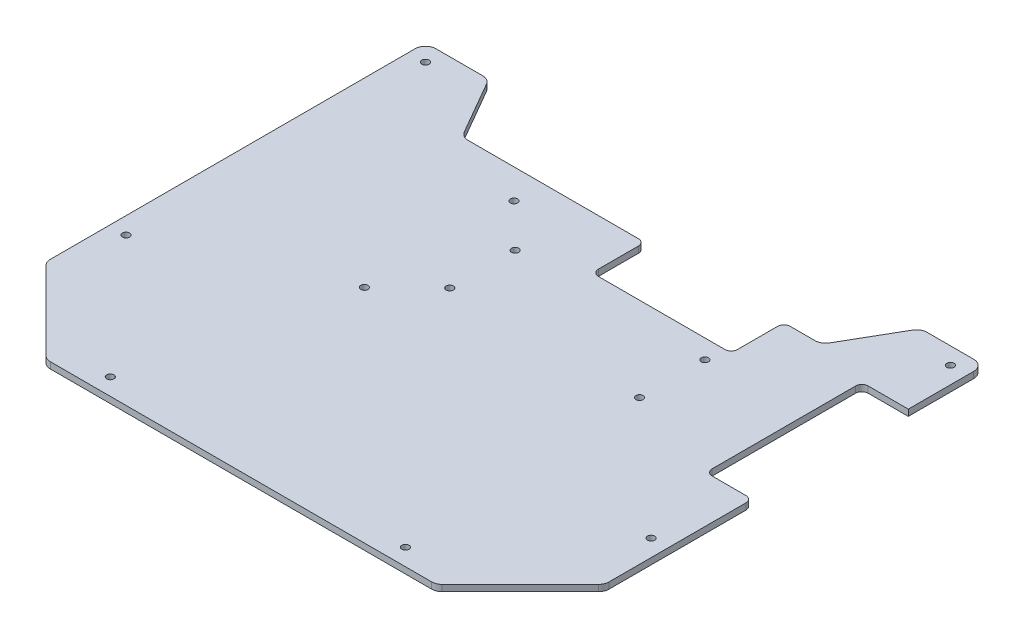
from build123d import *

# Parameters (mm, degrees)
BOSS_EXTRU_1_DEPTH      = 3
CONG_1_R                = 5
ESQUISSE2_R             = 1
ENL_V_MAT_EXTRU_1_DEPTH = 3
D_GAGEMENT_M31_D        = 3.4
ESQUISSE5_W             = 66
ESQUISSE5_H             = 25
ESQUISSE5_W_2           = 22
ESQUISSE5_H_2           = 74
ENL_V_MAT_EXTRU_2_DEPTH = 257.837010573
CONG_2_R                = 3
ESQUISSE6_R             = 1
ENL_V_MAT_EXTRU_3_DEPTH = 257.837010573
D_GAGEMENT_M32_D        = 3.4
D_GAGEMENT_M32_DEPTH    = 10
D_GAGEMENT_M32_TIP      = 1.021463052


with BuildPart() as part:
    # Esquisse1 → Boss.-Extru.1 (new body)
    with BuildSketch(Plane(origin=(0, 0, 0), x_dir=(1, 0, 0), z_dir=(0, 1, 0))):
        Polygon((-92.5, 0), (92.5, 0), (132.5, 40), (132.5, 220), (102.5, 220), (85.179491924, 190), (-85.179491924, 190), (-102.5, 220), (-132.5, 220), (-132.5, 40), align=None)
    extrude(amount=BOSS_EXTRU_1_DEPTH)

    # Congé1
    cong_1_edges = [part.edges().sort_by_distance(p)[0] for p in [
        (92.5, 1.5, 0),
        (132.5, 1.5, -40),
        (132.5, 1.5, -220),
        (102.5, 1.5, -220),
        (85.179491924, 1.5, -190),
        (-85.179491924, 1.5, -190),
        (-102.5, 1.5, -220),
        (-132.5, 1.5, -220),
        (-92.5, 1.5, 0),
        (-132.5, 1.5, -40),
    ]]
    fillet(cong_1_edges, radius=CONG_1_R)

    # Esquisse2 → Enlèv. mat.-Extru.1 (cut)
    with BuildSketch(Plane(origin=(0, 3, 0), x_dir=(1, 0, 0), z_dir=(0, 1, 0))):
        with Locations((70, 8)):
            Circle(ESQUISSE2_R)
        with Locations((124.5, 70)):
            Circle(ESQUISSE2_R)
        with Locations((124.5, 212)):
            Circle(ESQUISSE2_R)
        with Locations((-124.5, 212)):
            Circle(ESQUISSE2_R)
        with Locations((-124.5, 70)):
            Circle(ESQUISSE2_R)
        with Locations((-70, 8)):
            Circle(ESQUISSE2_R)
    extrude(amount=-ENL_V_MAT_EXTRU_1_DEPTH, mode=Mode.SUBTRACT)

    # Dégagement M31 (through all)
    with Locations(Plane(origin=(0, 3, 0), x_dir=(1, 0, 0), z_dir=(0, 1, 0))):
        with Locations((70, 8), (-70, 8), (-124.5, 70), (-124.5, 212), (124.5, 212), (124.5, 70)):
            Hole(D_GAGEMENT_M31_D / 2)

    # Esquisse5 → Enlèv. mat.-Extru.2 (cut, through all)
    with BuildSketch(Plane(origin=(0, 3, 0), x_dir=(1, 0, 0), z_dir=(0, 1, 0))):
        with Locations((34.5, 177.5)):
            Rectangle(ESQUISSE5_W, ESQUISSE5_H)
        with Locations((121.5, 147)):
            Rectangle(ESQUISSE5_W_2, ESQUISSE5_H_2)
    extrude(amount=-ENL_V_MAT_EXTRU_2_DEPTH, mode=Mode.SUBTRACT)

    # Congé2
    cong_2_edges = [part.edges().sort_by_distance(p)[0] for p in [
        (132.5, 1.5, -110),
        (110.5, 1.5, -110),
        (110.5, 1.5, -184),
        (67.5, 1.5, -190),
        (67.5, 1.5, -165),
        (1.5, 1.5, -165),
        (1.5, 1.5, -190),
    ]]
    fillet(cong_2_edges, radius=CONG_2_R)

    # Esquisse6 → Enlèv. mat.-Extru.3 (cut, through all)
    with BuildSketch(Plane(origin=(0, 3, 0), x_dir=(1, 0, 0), z_dir=(0, 1, 0))):
        with Locations((64, 156)):
            Circle(ESQUISSE6_R)
        with Locations((-26, 156)):
            Circle(ESQUISSE6_R)
        with Locations((-46.5, 176)):
            Circle(ESQUISSE6_R)
        with Locations((64, 125)):
            Circle(ESQUISSE6_R)
        with Locations((-26, 125)):
            Circle(ESQUISSE6_R)
        with Locations((-46.5, 105)):
            Circle(ESQUISSE6_R)
    extrude(amount=-ENL_V_MAT_EXTRU_3_DEPTH, mode=Mode.SUBTRACT)

    # Dégagement M32
    with Locations(Plane(origin=(0, 3, 0), x_dir=(1, 0, 0), z_dir=(0, 1, 0))):
        with Locations((-46.5, 105), (-26, 125), (-26, 156), (-46.5, 176), (64, 156), (64, 125)):
            Hole(D_GAGEMENT_M32_D / 2, depth=D_GAGEMENT_M32_DEPTH)
            with Locations((0, 0, -(D_GAGEMENT_M32_DEPTH + D_GAGEMENT_M32_TIP / 2))):  # 118° drill point
                Cone(0, D_GAGEMENT_M32_D / 2, D_GAGEMENT_M32_TIP, mode=Mode.SUBTRACT)


solid = part.part
